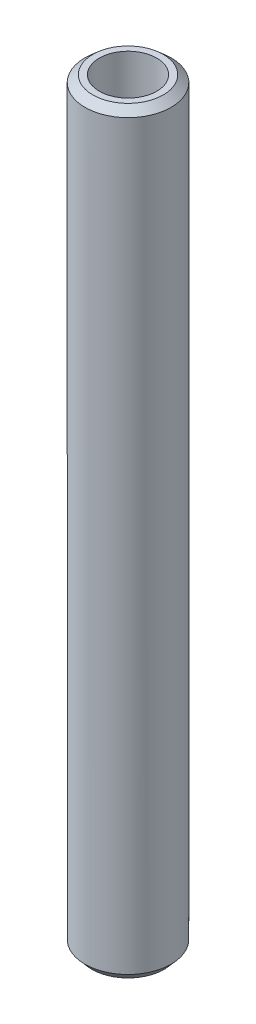
from build123d import *
from OCP.BRepFilletAPI import BRepFilletAPI_MakeChamfer

# Parameters (mm, degrees)
SKETCH1_R           = 10
BOSS_EXTRUDE1_DEPTH = 175.933963665
SKETCH2_R           = 6.682104886
CUT_EXTRUDE1_DEPTH  = 177.501443538
CHAMFER1_SIZE       = 1.589578288
CHAMFER1_SIZE2      = 1.825061922


with BuildPart() as part:
    # Sketch1 → Boss-Extrude1 (new body)
    with BuildSketch(Plane(origin=(0, 0, 0), x_dir=(1, 0, 0), z_dir=(0, 1, 0))):
        Circle(SKETCH1_R)
    extrude(amount=BOSS_EXTRUDE1_DEPTH)

    # Sketch2 → Cut-Extrude1 (cut, through all)
    with BuildSketch(Plane(origin=(0, 0, 0), x_dir=(1, 0, 0), z_dir=(0, 1, 0))):
        Circle(SKETCH2_R)
    extrude(amount=CUT_EXTRUDE1_DEPTH, mode=Mode.SUBTRACT)

    # Chamfer1: one chamfer whose edges measure the first distance from different faces: ONE call of the kernel's chamfer builder (chamfer() names one face for all edges)
    chamfer1_edges_1 = [part.edges().sort_by_distance(p)[0] for p in [
        (-10, 175.933963665, 0),
    ]]
    chamfer1_side_1 = [part.faces().sort_by_distance(p)[0] for p in [
        (-10, 87.966981832, 0),
    ]]
    chamfer1_edges_2 = [part.edges().sort_by_distance(p)[0] for p in [
        (-10, 0, 0),
    ]]
    chamfer1_side_2 = [part.faces().sort_by_distance(p)[0] for p in [
        (-9.717157288, 0, 0),
    ]]
    chamfer1 = BRepFilletAPI_MakeChamfer(part.part.solid().wrapped)
    for e in chamfer1_edges_1:
        chamfer1.Add(CHAMFER1_SIZE, CHAMFER1_SIZE2, e.wrapped, chamfer1_side_1[0].wrapped)  # the first distance lies on this face
    for e in chamfer1_edges_2:
        chamfer1.Add(CHAMFER1_SIZE, CHAMFER1_SIZE2, e.wrapped, chamfer1_side_2[0].wrapped)  # the first distance lies on this face
    add(Compound.cast(chamfer1.Shape()), mode=Mode.REPLACE)


solid = part.part
